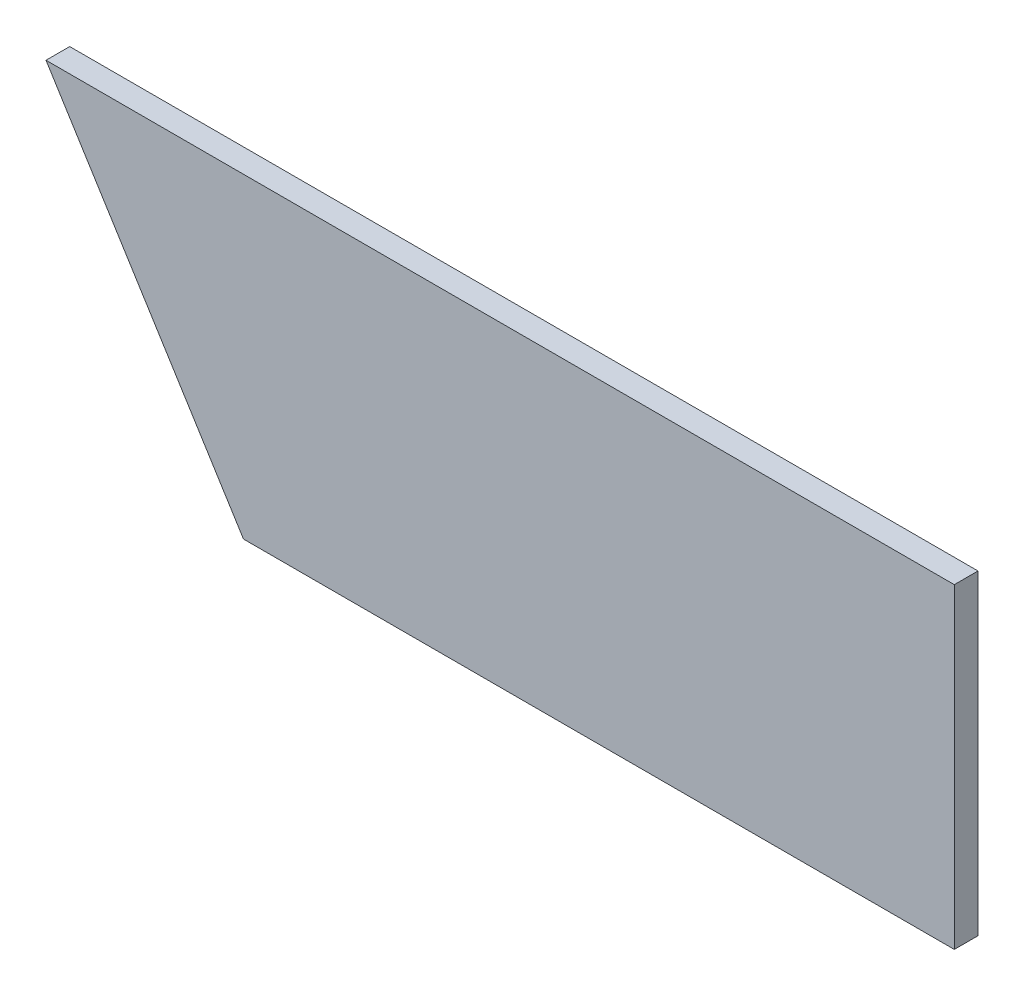
from build123d import *

# Parameters (mm, degrees)
T_LE_DE_BASE_PLI_E1_DEPTH = 3


# Sheet-metal steps are written as plain solids
with BuildPart() as part:
    # Esquisse1 → Tôle de base pliée1 (new body)
    with BuildSketch(Plane.XY):
        Polygon((25, 0), (115, 0), (115, 40), (0, 40), align=None)
    extrude(amount=-T_LE_DE_BASE_PLI_E1_DEPTH)


solid = part.part
